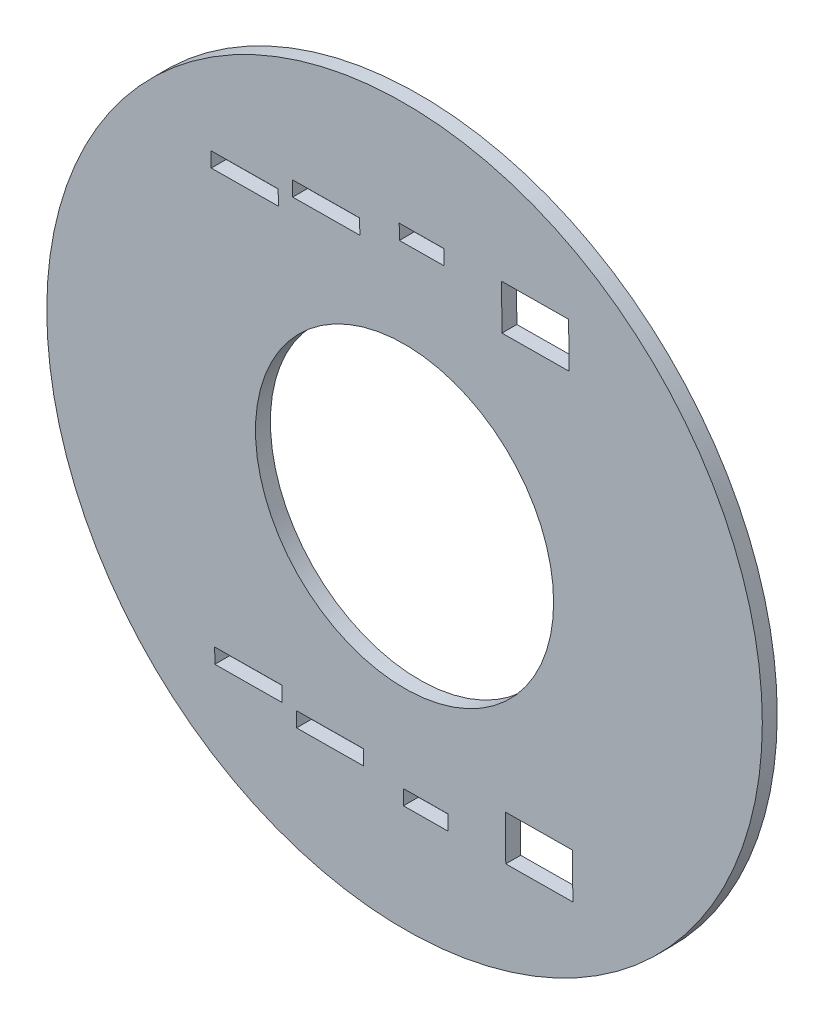
from build123d import *

# Parameters (mm, degrees)
SKETCH1_R           = 76.2
SKETCH1_R_2         = 31.75
BOSS_EXTRUDE1_DEPTH = 3.175
CAVITY1_START       = -53.511255689
CAVITY1_OUTLINE_W   = 14.2875
CAVITY1_OUTLINE_H   = 3.175
CAVITY1_DEPTH       = 9.525
CAVITY1_START_2     = 43.986255689
CAVITY1_2_OUTLINE_W = 14.2875
CAVITY1_2_OUTLINE_H = 3.175
CAVITY1_2_DEPTH     = 9.525
CAVITY1_START_3     = -50.336255689
CAVITY1_3_OUTLINE_W = 14.2875
CAVITY1_3_OUTLINE_H = 3.175
CAVITY1_3_DEPTH     = 3.175
CAVITY1_START_4     = -47.161255689
CAVITY1_4_OUTLINE_W = 14.2875
CAVITY1_4_OUTLINE_H = 3.175
CAVITY1_4_DEPTH     = 3.175
CAVITY1_5_OUTLINE_W = 14.2875
CAVITY1_5_OUTLINE_H = 3.175
CAVITY1_5_DEPTH     = 3.175
CAVITY1_START_5     = 47.161255689
CAVITY1_6_OUTLINE_W = 14.2875
CAVITY1_6_OUTLINE_H = 3.175
CAVITY1_6_DEPTH     = 3.175
CAVITY1_7_OUTLINE_W = 9.525
CAVITY1_7_OUTLINE_H = 3.175
CAVITY1_7_DEPTH     = 3.175
CAVITY1_START_6     = 50.336255689
CAVITY1_8_OUTLINE_W = 9.525
CAVITY1_8_OUTLINE_H = 3.175
CAVITY1_8_DEPTH     = 3.175


# Read off the part's stored shape, not the designer's step: Cavity1
with BuildPart() as part:
    # Sketch1 → Boss-Extrude1 (new body)
    with BuildSketch(Plane.XY):
        Circle(SKETCH1_R)
        Circle(SKETCH1_R_2, mode=Mode.SUBTRACT)
    extrude(amount=BOSS_EXTRUDE1_DEPTH)

    # Cavity1 outline → Cavity1 (cut)
    with BuildSketch(Plane(origin=(0, 0, 0), x_dir=(0.9999649697426024, 0.008370142631770718, 0), z_dir=(0.008370142631770716, -0.9999649697426025, 0)).offset(CAVITY1_START)):
        with Locations((28.254299641, 1.5875)):
            Rectangle(CAVITY1_OUTLINE_W, CAVITY1_OUTLINE_H)
    extrude(amount=CAVITY1_DEPTH, mode=Mode.SUBTRACT)

    # Cavity1 2 outline → Cavity1 2 (cut)
    with BuildSketch(Plane(origin=(0, 0, 0), x_dir=(0.9999649697426024, 0.008370142631770718, 0), z_dir=(0.008370142631770716, -0.9999649697426025, 0)).offset(CAVITY1_START_2)):
        with Locations((28.254299641, 1.5875)):
            Rectangle(CAVITY1_2_OUTLINE_W, CAVITY1_2_OUTLINE_H)
    extrude(amount=CAVITY1_2_DEPTH, mode=Mode.SUBTRACT)

    # Cavity1 3 outline → Cavity1 3 (cut)
    with BuildSketch(Plane(origin=(0, 0, 0), x_dir=(0.9999649697426024, 0.008370142631770718, 0), z_dir=(0.008370142631770716, -0.9999649697426025, 0)).offset(CAVITY1_START_3)):
        with Locations((-16.280608677, 1.5875)):
            Rectangle(CAVITY1_3_OUTLINE_W, CAVITY1_3_OUTLINE_H)
    extrude(amount=CAVITY1_3_DEPTH, mode=Mode.SUBTRACT)

    # Cavity1 4 outline → Cavity1 4 (cut)
    with BuildSketch(Plane(origin=(0, 0, 0), x_dir=(0.9999649697426024, 0.008370142631770718, 0), z_dir=(0.008370142631770716, -0.9999649697426025, 0)).offset(CAVITY1_START_4)):
        with Locations((-33.658200359, 1.5875)):
            Rectangle(CAVITY1_4_OUTLINE_W, CAVITY1_4_OUTLINE_H)
    extrude(amount=CAVITY1_4_DEPTH, mode=Mode.SUBTRACT)

    # Cavity1 5 outline → Cavity1 5 (cut)
    with BuildSketch(Plane(origin=(0, 0, 0), x_dir=(0.9999649697426024, 0.008370142631770718, 0), z_dir=(0.008370142631770716, -0.9999649697426025, 0)).offset(CAVITY1_START_2)):
        with Locations((-33.658200359, 1.5875)):
            Rectangle(CAVITY1_5_OUTLINE_W, CAVITY1_5_OUTLINE_H)
    extrude(amount=CAVITY1_5_DEPTH, mode=Mode.SUBTRACT)

    # Cavity1 6 outline → Cavity1 6 (cut)
    with BuildSketch(Plane(origin=(0, 0, 0), x_dir=(0.9999649697426024, 0.008370142631770718, 0), z_dir=(0.008370142631770716, -0.9999649697426025, 0)).offset(CAVITY1_START_5)):
        with Locations((-16.280608677, 1.5875)):
            Rectangle(CAVITY1_6_OUTLINE_W, CAVITY1_6_OUTLINE_H)
    extrude(amount=CAVITY1_6_DEPTH, mode=Mode.SUBTRACT)

    # Cavity1 7 outline → Cavity1 7 (cut)
    with BuildSketch(Plane(origin=(0, 0, 0), x_dir=(0.9999649697426024, 0.008370142631770718, 0), z_dir=(0.008370142631770716, -0.9999649697426025, 0)).offset(CAVITY1_START)):
        with Locations((4.078332174, 1.5875)):
            Rectangle(CAVITY1_7_OUTLINE_W, CAVITY1_7_OUTLINE_H)
    extrude(amount=CAVITY1_7_DEPTH, mode=Mode.SUBTRACT)

    # Cavity1 8 outline → Cavity1 8 (cut)
    with BuildSketch(Plane(origin=(0, 0, 0), x_dir=(0.9999649697426024, 0.008370142631770718, 0), z_dir=(0.008370142631770716, -0.9999649697426025, 0)).offset(CAVITY1_START_6)):
        with Locations((4.078332174, 1.5875)):
            Rectangle(CAVITY1_8_OUTLINE_W, CAVITY1_8_OUTLINE_H)
    extrude(amount=CAVITY1_8_DEPTH, mode=Mode.SUBTRACT)


solid = part.part
